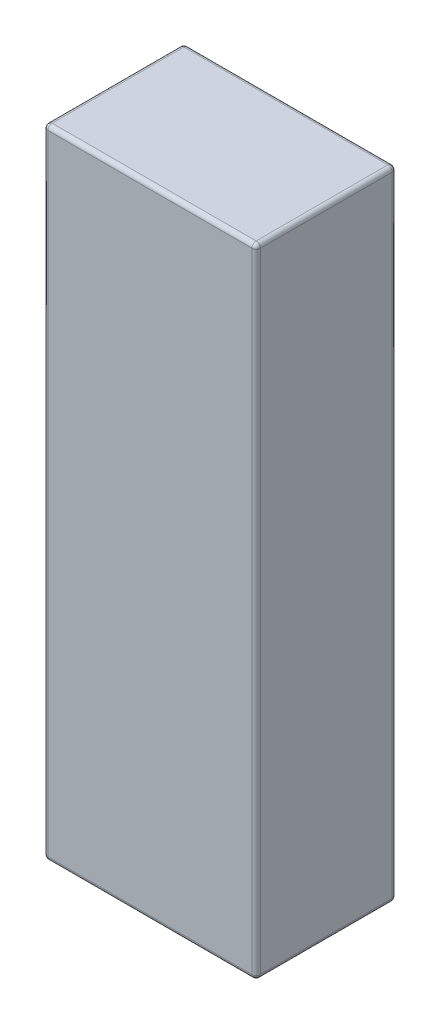
from build123d import *

# Parameters (mm, degrees)
SKETCH1_W           = 50
SKETCH1_H           = 33
BOSS_EXTRUDE1_DEPTH = 75
FILLET1_R           = 1


with BuildPart() as part:
    # Sketch1 → Boss-Extrude1 (new, symmetric)
    with BuildSketch(Plane(origin=(0, 0, 0), x_dir=(1, 0, 0), z_dir=(0, 1, 0))):
        Rectangle(SKETCH1_W, SKETCH1_H)
    extrude(amount=BOSS_EXTRUDE1_DEPTH, both=True)

    # Fillet1
    fillet1_edges = [part.edges().sort_by_distance(p)[0] for p in [
        (25, 0, -16.5),
        (-25, 0, -16.5),
        (-25, 0, 16.5),
        (25, 0, 16.5),
        (0, -75, -16.5),
        (-25, -75, 0),
        (0, -75, 16.5),
        (25, -75, 0),
        (0, 75, 16.5),
        (-25, 75, 0),
        (0, 75, -16.5),
        (25, 75, 0),
    ]]
    fillet(fillet1_edges, radius=FILLET1_R)


solid = part.part
